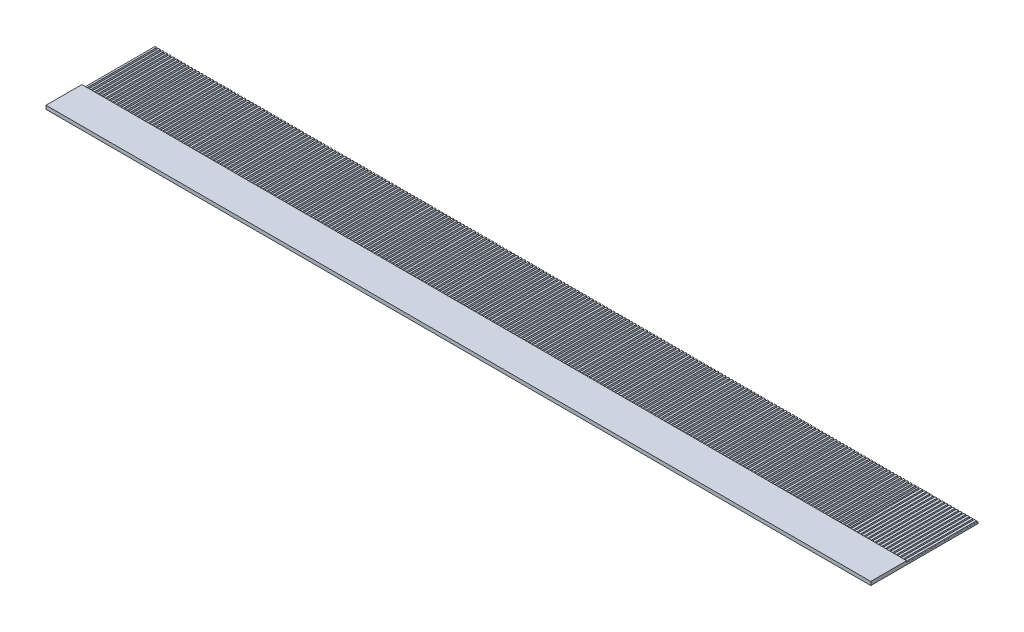
from build123d import *

# Parameters (mm, degrees)
SKETCH1_W           = 115
SKETCH1_H           = 15
BOSS_EXTRUDE1_DEPTH = 0.5
SKETCH3_W           = 115
SKETCH3_H           = 10
CUT_EXTRUDE3_DEPTH  = 0.25
SKETCH5_W           = 0.25
SKETCH5_H           = 10
CUT_EXTRUDE5_DEPTH  = 1
SKETCH6_W           = 118.166376746
SKETCH6_H           = 4.208284173
CUT_EXTRUDE6_DEPTH  = 1
SKETCH7_W           = 0.193475549
SKETCH7_H           = 9.95
CUT_EXTRUDE7_DEPTH  = 10
LPATTERN1_COUNT     = 150
LPATTERN1_PITCH     = 0.5


with BuildPart() as part:
    # Sketch1 → Boss-Extrude1 (new body)
    with BuildSketch(Plane(origin=(0, 0, 0), x_dir=(1, 0, 0), z_dir=(0, 1, 0))):
        with Locations((57.5, 7.5)):
            Rectangle(SKETCH1_W, SKETCH1_H)
    extrude(amount=BOSS_EXTRUDE1_DEPTH)

    # Sketch3 → Cut-Extrude3 (cut)
    with BuildSketch(Plane(origin=(0, 0.5, 0), x_dir=(1, 0, 0), z_dir=(0, 1, 0))):
        with Locations((57.5, 10)):
            Rectangle(SKETCH3_W, SKETCH3_H)
    extrude(amount=-CUT_EXTRUDE3_DEPTH, mode=Mode.SUBTRACT)

    # Sketch5 → Cut-Extrude5 (cut)
    with BuildSketch(Plane(origin=(0, 0.25, 0), x_dir=(1, 0, 0), z_dir=(0, 1, 0))):
        with Locations((0.125, 10)):
            Rectangle(SKETCH5_W, SKETCH5_H)
        with Locations((0.620446679, 9.998961906)):
            Rectangle(SKETCH5_W, SKETCH5_H)
        with Locations((1.116352193, 10.002779153)):
            Rectangle(SKETCH5_W, SKETCH5_H)
        with Locations((1.620868249, 10.001962647)):
            Rectangle(SKETCH5_W, SKETCH5_H)
        with Locations((2.116314928, 10.000924553)):
            Rectangle(SKETCH5_W, SKETCH5_H)
        with Locations((2.612220442, 10.0047418)):
            Rectangle(SKETCH5_W, SKETCH5_H)
        with Locations((3.139907648, 9.997960294)):
            Rectangle(SKETCH5_W, SKETCH5_H)
        with Locations((3.635354327, 9.996922201)):
            Rectangle(SKETCH5_W, SKETCH5_H)
        with Locations((4.13125984, 10.000739447)):
            Rectangle(SKETCH5_W, SKETCH5_H)
        with Locations((4.635775897, 9.999922941)):
            Rectangle(SKETCH5_W, SKETCH5_H)
        with Locations((5.131222576, 9.998884848)):
            Rectangle(SKETCH5_W, SKETCH5_H)
        with Locations((5.62712809, 10.002702094)):
            Rectangle(SKETCH5_W, SKETCH5_H)
        with Locations((6.106126495, 9.996343927)):
            Rectangle(SKETCH5_W, SKETCH5_H)
        with Locations((6.601573174, 9.995305834)):
            Rectangle(SKETCH5_W, SKETCH5_H)
        with Locations((7.097478688, 9.99912308)):
            Rectangle(SKETCH5_W, SKETCH5_H)
        with Locations((7.601994745, 9.998306574)):
            Rectangle(SKETCH5_W, SKETCH5_H)
        with Locations((8.097441424, 9.997268481)):
            Rectangle(SKETCH5_W, SKETCH5_H)
        with Locations((8.593346937, 10.001085727)):
            Rectangle(SKETCH5_W, SKETCH5_H)
        with Locations((9.121034143, 9.994304222)):
            Rectangle(SKETCH5_W, SKETCH5_H)
        with Locations((9.616480822, 9.993266128)):
            Rectangle(SKETCH5_W, SKETCH5_H)
        with Locations((10.112386336, 9.997083374)):
            Rectangle(SKETCH5_W, SKETCH5_H)
        with Locations((10.616902392, 9.996266869)):
            Rectangle(SKETCH5_W, SKETCH5_H)
        with Locations((11.112349071, 9.995228775)):
            Rectangle(SKETCH5_W, SKETCH5_H)
        with Locations((11.608254585, 9.999046021)):
            Rectangle(SKETCH5_W, SKETCH5_H)
        with Locations((12.097394126, 10.029678014)):
            Rectangle(SKETCH5_W, SKETCH5_H)
        with Locations((12.592840805, 10.02863992)):
            Rectangle(SKETCH5_W, SKETCH5_H)
        with Locations((13.088746319, 10.032457167)):
            Rectangle(SKETCH5_W, SKETCH5_H)
        with Locations((13.593262375, 10.031640661)):
            Rectangle(SKETCH5_W, SKETCH5_H)
        with Locations((14.088709054, 10.030602567)):
            Rectangle(SKETCH5_W, SKETCH5_H)
        with Locations((14.584614568, 10.034419814)):
            Rectangle(SKETCH5_W, SKETCH5_H)
        with Locations((15.112301774, 10.027638308)):
            Rectangle(SKETCH5_W, SKETCH5_H)
        with Locations((15.607748453, 10.026600215)):
            Rectangle(SKETCH5_W, SKETCH5_H)
        with Locations((16.103653966, 10.030417461)):
            Rectangle(SKETCH5_W, SKETCH5_H)
        with Locations((16.608170023, 10.029600955)):
            Rectangle(SKETCH5_W, SKETCH5_H)
        with Locations((17.103616702, 10.028562862)):
            Rectangle(SKETCH5_W, SKETCH5_H)
        with Locations((17.599522216, 10.032380108)):
            Rectangle(SKETCH5_W, SKETCH5_H)
        with Locations((18.078520622, 10.026021941)):
            Rectangle(SKETCH5_W, SKETCH5_H)
        with Locations((18.573967301, 10.024983848)):
            Rectangle(SKETCH5_W, SKETCH5_H)
        with Locations((19.069872814, 10.028801094)):
            Rectangle(SKETCH5_W, SKETCH5_H)
        with Locations((19.574388871, 10.027984588)):
            Rectangle(SKETCH5_W, SKETCH5_H)
        with Locations((20.06983555, 10.026946495)):
            Rectangle(SKETCH5_W, SKETCH5_H)
        with Locations((20.565741064, 10.030763741)):
            Rectangle(SKETCH5_W, SKETCH5_H)
        with Locations((21.093428269, 10.023982236)):
            Rectangle(SKETCH5_W, SKETCH5_H)
        with Locations((21.588874948, 10.022944142)):
            Rectangle(SKETCH5_W, SKETCH5_H)
        with Locations((22.084780462, 10.026761388)):
            Rectangle(SKETCH5_W, SKETCH5_H)
        with Locations((22.589296518, 10.025944883)):
            Rectangle(SKETCH5_W, SKETCH5_H)
        with Locations((23.084743197, 10.024906789)):
            Rectangle(SKETCH5_W, SKETCH5_H)
        with Locations((23.580648711, 10.028724035)):
            Rectangle(SKETCH5_W, SKETCH5_H)
        with Locations((24.100852619, 10.024757009)):
            Rectangle(SKETCH5_W, SKETCH5_H)
        with Locations((24.596299298, 10.023718915)):
            Rectangle(SKETCH5_W, SKETCH5_H)
        with Locations((25.092204812, 10.027536162)):
            Rectangle(SKETCH5_W, SKETCH5_H)
        with Locations((25.596720868, 10.026719656)):
            Rectangle(SKETCH5_W, SKETCH5_H)
        with Locations((26.092167547, 10.025681562)):
            Rectangle(SKETCH5_W, SKETCH5_H)
        with Locations((26.588073061, 10.029498809)):
            Rectangle(SKETCH5_W, SKETCH5_H)
        with Locations((27.115760267, 10.022717304)):
            Rectangle(SKETCH5_W, SKETCH5_H)
        with Locations((27.611206946, 10.02167921)):
            Rectangle(SKETCH5_W, SKETCH5_H)
        with Locations((28.107112459, 10.025496456)):
            Rectangle(SKETCH5_W, SKETCH5_H)
        with Locations((28.611628516, 10.02467995)):
            Rectangle(SKETCH5_W, SKETCH5_H)
        with Locations((29.107075195, 10.023641857)):
            Rectangle(SKETCH5_W, SKETCH5_H)
        with Locations((29.602980709, 10.027459103)):
            Rectangle(SKETCH5_W, SKETCH5_H)
        with Locations((30.081979114, 10.021100936)):
            Rectangle(SKETCH5_W, SKETCH5_H)
        with Locations((30.577425793, 10.020062843)):
            Rectangle(SKETCH5_W, SKETCH5_H)
        with Locations((31.073331307, 10.023880089)):
            Rectangle(SKETCH5_W, SKETCH5_H)
        with Locations((31.577847364, 10.023063583)):
            Rectangle(SKETCH5_W, SKETCH5_H)
        with Locations((32.073294043, 10.02202549)):
            Rectangle(SKETCH5_W, SKETCH5_H)
        with Locations((32.569199556, 10.025842736)):
            Rectangle(SKETCH5_W, SKETCH5_H)
        with Locations((33.096886762, 10.019061231)):
            Rectangle(SKETCH5_W, SKETCH5_H)
        with Locations((33.592333441, 10.018023137)):
            Rectangle(SKETCH5_W, SKETCH5_H)
        with Locations((34.088238955, 10.021840383)):
            Rectangle(SKETCH5_W, SKETCH5_H)
        with Locations((34.592755011, 10.021023878)):
            Rectangle(SKETCH5_W, SKETCH5_H)
        with Locations((35.08820169, 10.019985784)):
            Rectangle(SKETCH5_W, SKETCH5_H)
        with Locations((35.584107204, 10.02380303)):
            Rectangle(SKETCH5_W, SKETCH5_H)
        with Locations((36.073246745, 10.054435023)):
            Rectangle(SKETCH5_W, SKETCH5_H)
        with Locations((36.568693424, 10.053396929)):
            Rectangle(SKETCH5_W, SKETCH5_H)
        with Locations((37.064598938, 10.057214176)):
            Rectangle(SKETCH5_W, SKETCH5_H)
        with Locations((37.569114994, 10.05639767)):
            Rectangle(SKETCH5_W, SKETCH5_H)
        with Locations((38.064561673, 10.055359576)):
            Rectangle(SKETCH5_W, SKETCH5_H)
        with Locations((38.560467187, 10.059176823)):
            Rectangle(SKETCH5_W, SKETCH5_H)
        with Locations((39.088154393, 10.052395318)):
            Rectangle(SKETCH5_W, SKETCH5_H)
        with Locations((39.583601072, 10.051357224)):
            Rectangle(SKETCH5_W, SKETCH5_H)
        with Locations((40.079506585, 10.05517447)):
            Rectangle(SKETCH5_W, SKETCH5_H)
        with Locations((40.584022642, 10.054357964)):
            Rectangle(SKETCH5_W, SKETCH5_H)
        with Locations((41.079469321, 10.053319871)):
            Rectangle(SKETCH5_W, SKETCH5_H)
        with Locations((41.575374835, 10.057137117)):
            Rectangle(SKETCH5_W, SKETCH5_H)
        with Locations((42.054373241, 10.05077895)):
            Rectangle(SKETCH5_W, SKETCH5_H)
        with Locations((42.54981992, 10.049740857)):
            Rectangle(SKETCH5_W, SKETCH5_H)
        with Locations((43.045725433, 10.053558103)):
            Rectangle(SKETCH5_W, SKETCH5_H)
        with Locations((43.55024149, 10.052741597)):
            Rectangle(SKETCH5_W, SKETCH5_H)
        with Locations((44.045688169, 10.051703504)):
            Rectangle(SKETCH5_W, SKETCH5_H)
        with Locations((44.541593683, 10.05552075)):
            Rectangle(SKETCH5_W, SKETCH5_H)
        with Locations((45.069280888, 10.048739245)):
            Rectangle(SKETCH5_W, SKETCH5_H)
        with Locations((45.564727567, 10.047701151)):
            Rectangle(SKETCH5_W, SKETCH5_H)
        with Locations((46.060633081, 10.051518397)):
            Rectangle(SKETCH5_W, SKETCH5_H)
        with Locations((46.565149137, 10.050701892)):
            Rectangle(SKETCH5_W, SKETCH5_H)
        with Locations((47.060595816, 10.049663798)):
            Rectangle(SKETCH5_W, SKETCH5_H)
        with Locations((47.55650133, 10.053481044)):
            Rectangle(SKETCH5_W, SKETCH5_H)
        with Locations((48.060902316, 9.957855161)):
            Rectangle(SKETCH5_W, SKETCH5_H)
        with Locations((48.556348995, 9.956817068)):
            Rectangle(SKETCH5_W, SKETCH5_H)
        with Locations((49.052254509, 9.960634314)):
            Rectangle(SKETCH5_W, SKETCH5_H)
        with Locations((49.556770565, 9.959817808)):
            Rectangle(SKETCH5_W, SKETCH5_H)
        with Locations((50.052217244, 9.958779715)):
            Rectangle(SKETCH5_W, SKETCH5_H)
        with Locations((50.548122758, 9.962596961)):
            Rectangle(SKETCH5_W, SKETCH5_H)
        with Locations((51.075809963, 9.955815456)):
            Rectangle(SKETCH5_W, SKETCH5_H)
        with Locations((51.571256642, 9.954777362)):
            Rectangle(SKETCH5_W, SKETCH5_H)
        with Locations((52.067162156, 9.958594608)):
            Rectangle(SKETCH5_W, SKETCH5_H)
        with Locations((52.571678213, 9.957778103)):
            Rectangle(SKETCH5_W, SKETCH5_H)
        with Locations((53.067124892, 9.956740009)):
            Rectangle(SKETCH5_W, SKETCH5_H)
        with Locations((53.563030405, 9.960557255)):
            Rectangle(SKETCH5_W, SKETCH5_H)
        with Locations((54.042028811, 9.954199089)):
            Rectangle(SKETCH5_W, SKETCH5_H)
        with Locations((54.53747549, 9.953160995)):
            Rectangle(SKETCH5_W, SKETCH5_H)
        with Locations((55.033381004, 9.956978241)):
            Rectangle(SKETCH5_W, SKETCH5_H)
        with Locations((55.537897061, 9.956161736)):
            Rectangle(SKETCH5_W, SKETCH5_H)
        with Locations((56.03334374, 9.955123642)):
            Rectangle(SKETCH5_W, SKETCH5_H)
        with Locations((56.529249253, 9.958940888)):
            Rectangle(SKETCH5_W, SKETCH5_H)
        with Locations((57.056936459, 9.952159383)):
            Rectangle(SKETCH5_W, SKETCH5_H)
        with Locations((57.552383138, 9.951121289)):
            Rectangle(SKETCH5_W, SKETCH5_H)
        with Locations((58.048288652, 9.954938536)):
            Rectangle(SKETCH5_W, SKETCH5_H)
        with Locations((58.552804708, 9.95412203)):
            Rectangle(SKETCH5_W, SKETCH5_H)
        with Locations((59.048251387, 9.953083936)):
            Rectangle(SKETCH5_W, SKETCH5_H)
        with Locations((59.544156901, 9.956901183)):
            Rectangle(SKETCH5_W, SKETCH5_H)
        with Locations((60.033296442, 9.987533175)):
            Rectangle(SKETCH5_W, SKETCH5_H)
        with Locations((60.528743121, 9.986495082)):
            Rectangle(SKETCH5_W, SKETCH5_H)
        with Locations((61.024648635, 9.990312328)):
            Rectangle(SKETCH5_W, SKETCH5_H)
        with Locations((61.529164691, 9.989495822)):
            Rectangle(SKETCH5_W, SKETCH5_H)
        with Locations((62.02461137, 9.988457729)):
            Rectangle(SKETCH5_W, SKETCH5_H)
        with Locations((62.520516884, 9.992274975)):
            Rectangle(SKETCH5_W, SKETCH5_H)
        with Locations((63.04820409, 9.98549347)):
            Rectangle(SKETCH5_W, SKETCH5_H)
        with Locations((63.543650769, 9.984455376)):
            Rectangle(SKETCH5_W, SKETCH5_H)
        with Locations((64.039556282, 9.988272622)):
            Rectangle(SKETCH5_W, SKETCH5_H)
        with Locations((64.544072339, 9.987456117)):
            Rectangle(SKETCH5_W, SKETCH5_H)
        with Locations((65.039519018, 9.986418023)):
            Rectangle(SKETCH5_W, SKETCH5_H)
        with Locations((65.535424532, 9.990235269)):
            Rectangle(SKETCH5_W, SKETCH5_H)
        with Locations((66.014422937, 9.983877103)):
            Rectangle(SKETCH5_W, SKETCH5_H)
        with Locations((66.509869616, 9.982839009)):
            Rectangle(SKETCH5_W, SKETCH5_H)
        with Locations((67.00577513, 9.986656255)):
            Rectangle(SKETCH5_W, SKETCH5_H)
        with Locations((67.510291187, 9.98583975)):
            Rectangle(SKETCH5_W, SKETCH5_H)
        with Locations((68.005737866, 9.984801656)):
            Rectangle(SKETCH5_W, SKETCH5_H)
        with Locations((68.501643379, 9.988618902)):
            Rectangle(SKETCH5_W, SKETCH5_H)
        with Locations((69.029330585, 9.981837397)):
            Rectangle(SKETCH5_W, SKETCH5_H)
        with Locations((69.524777264, 9.980799303)):
            Rectangle(SKETCH5_W, SKETCH5_H)
        with Locations((70.020682778, 9.98461655)):
            Rectangle(SKETCH5_W, SKETCH5_H)
        with Locations((70.525198834, 9.983800044)):
            Rectangle(SKETCH5_W, SKETCH5_H)
        with Locations((71.020645513, 9.98276195)):
            Rectangle(SKETCH5_W, SKETCH5_H)
        with Locations((71.516551027, 9.986579197)):
            Rectangle(SKETCH5_W, SKETCH5_H)
        with Locations((72.036754935, 9.982612171)):
            Rectangle(SKETCH5_W, SKETCH5_H)
        with Locations((72.532201614, 9.981574077)):
            Rectangle(SKETCH5_W, SKETCH5_H)
        with Locations((73.028107128, 9.985391323)):
            Rectangle(SKETCH5_W, SKETCH5_H)
        with Locations((73.532623184, 9.984574818)):
            Rectangle(SKETCH5_W, SKETCH5_H)
        with Locations((74.028069863, 9.983536724)):
            Rectangle(SKETCH5_W, SKETCH5_H)
        with Locations((74.523975377, 9.98735397)):
            Rectangle(SKETCH5_W, SKETCH5_H)
        with Locations((75.051662582, 9.980572465)):
            Rectangle(SKETCH5_W, SKETCH5_H)
        with Locations((75.547109261, 9.979534371)):
            Rectangle(SKETCH5_W, SKETCH5_H)
        with Locations((76.043014775, 9.983351618)):
            Rectangle(SKETCH5_W, SKETCH5_H)
        with Locations((76.547530832, 9.982535112)):
            Rectangle(SKETCH5_W, SKETCH5_H)
        with Locations((77.042977511, 9.981497018)):
            Rectangle(SKETCH5_W, SKETCH5_H)
        with Locations((77.538883024, 9.985314264)):
            Rectangle(SKETCH5_W, SKETCH5_H)
        with Locations((78.01788143, 9.978956098)):
            Rectangle(SKETCH5_W, SKETCH5_H)
        with Locations((78.513328109, 9.977918004)):
            Rectangle(SKETCH5_W, SKETCH5_H)
        with Locations((79.009233623, 9.98173525)):
            Rectangle(SKETCH5_W, SKETCH5_H)
        with Locations((79.51374968, 9.980918745)):
            Rectangle(SKETCH5_W, SKETCH5_H)
        with Locations((80.009196359, 9.979880651)):
            Rectangle(SKETCH5_W, SKETCH5_H)
        with Locations((80.505101872, 9.983697897)):
            Rectangle(SKETCH5_W, SKETCH5_H)
        with Locations((81.032789078, 9.976916392)):
            Rectangle(SKETCH5_W, SKETCH5_H)
        with Locations((81.528235757, 9.975878299)):
            Rectangle(SKETCH5_W, SKETCH5_H)
        with Locations((82.024141271, 9.979695545)):
            Rectangle(SKETCH5_W, SKETCH5_H)
        with Locations((82.528657327, 9.978879039)):
            Rectangle(SKETCH5_W, SKETCH5_H)
        with Locations((83.024104006, 9.977840946)):
            Rectangle(SKETCH5_W, SKETCH5_H)
        with Locations((83.52000952, 9.981658192)):
            Rectangle(SKETCH5_W, SKETCH5_H)
        with Locations((84.009149061, 10.012290185)):
            Rectangle(SKETCH5_W, SKETCH5_H)
        with Locations((84.50459574, 10.011252091)):
            Rectangle(SKETCH5_W, SKETCH5_H)
        with Locations((85.000501254, 10.015069337)):
            Rectangle(SKETCH5_W, SKETCH5_H)
        with Locations((85.50501731, 10.014252832)):
            Rectangle(SKETCH5_W, SKETCH5_H)
        with Locations((86.000463989, 10.013214738)):
            Rectangle(SKETCH5_W, SKETCH5_H)
        with Locations((86.496369503, 10.017031984)):
            Rectangle(SKETCH5_W, SKETCH5_H)
        with Locations((87.024056709, 10.010250479)):
            Rectangle(SKETCH5_W, SKETCH5_H)
        with Locations((87.519503388, 10.009212385)):
            Rectangle(SKETCH5_W, SKETCH5_H)
        with Locations((88.015408901, 10.013029632)):
            Rectangle(SKETCH5_W, SKETCH5_H)
        with Locations((88.519924958, 10.012213126)):
            Rectangle(SKETCH5_W, SKETCH5_H)
        with Locations((89.015371637, 10.011175032)):
            Rectangle(SKETCH5_W, SKETCH5_H)
        with Locations((89.511277151, 10.014992278)):
            Rectangle(SKETCH5_W, SKETCH5_H)
        with Locations((89.990275556, 10.008634112)):
            Rectangle(SKETCH5_W, SKETCH5_H)
        with Locations((90.485722235, 10.007596018)):
            Rectangle(SKETCH5_W, SKETCH5_H)
        with Locations((90.981627749, 10.011413264)):
            Rectangle(SKETCH5_W, SKETCH5_H)
        with Locations((91.486143806, 10.010596759)):
            Rectangle(SKETCH5_W, SKETCH5_H)
        with Locations((91.981590485, 10.009558665)):
            Rectangle(SKETCH5_W, SKETCH5_H)
        with Locations((92.477495998, 10.013375911)):
            Rectangle(SKETCH5_W, SKETCH5_H)
        with Locations((93.005183204, 10.006594406)):
            Rectangle(SKETCH5_W, SKETCH5_H)
        with Locations((93.500629883, 10.005556313)):
            Rectangle(SKETCH5_W, SKETCH5_H)
        with Locations((93.996535397, 10.009373559)):
            Rectangle(SKETCH5_W, SKETCH5_H)
        with Locations((94.501051453, 10.008557053)):
            Rectangle(SKETCH5_W, SKETCH5_H)
        with Locations((94.996498132, 10.00751896)):
            Rectangle(SKETCH5_W, SKETCH5_H)
        with Locations((95.492403646, 10.011336206)):
            Rectangle(SKETCH5_W, SKETCH5_H)
        with Locations((95.961193403, 10.019132397)):
            Rectangle(SKETCH5_W, SKETCH5_H)
        with Locations((96.46570946, 10.018315892)):
            Rectangle(SKETCH5_W, SKETCH5_H)
        with Locations((96.961156139, 10.017277798)):
            Rectangle(SKETCH5_W, SKETCH5_H)
        with Locations((97.457061652, 10.021095044)):
            Rectangle(SKETCH5_W, SKETCH5_H)
        with Locations((97.984748858, 10.014313539)):
            Rectangle(SKETCH5_W, SKETCH5_H)
        with Locations((98.480195537, 10.013275445)):
            Rectangle(SKETCH5_W, SKETCH5_H)
        with Locations((98.976101051, 10.017092692)):
            Rectangle(SKETCH5_W, SKETCH5_H)
        with Locations((99.480617107, 10.016276186)):
            Rectangle(SKETCH5_W, SKETCH5_H)
        with Locations((99.976063786, 10.015238092)):
            Rectangle(SKETCH5_W, SKETCH5_H)
        with Locations((100.4719693, 10.019055339)):
            Rectangle(SKETCH5_W, SKETCH5_H)
        with Locations((100.950967706, 10.012697172)):
            Rectangle(SKETCH5_W, SKETCH5_H)
        with Locations((101.446414385, 10.011659078)):
            Rectangle(SKETCH5_W, SKETCH5_H)
        with Locations((101.942319899, 10.015476324)):
            Rectangle(SKETCH5_W, SKETCH5_H)
        with Locations((102.446835955, 10.014659819)):
            Rectangle(SKETCH5_W, SKETCH5_H)
        with Locations((102.942282634, 10.013621725)):
            Rectangle(SKETCH5_W, SKETCH5_H)
        with Locations((103.438188148, 10.017438971)):
            Rectangle(SKETCH5_W, SKETCH5_H)
        with Locations((103.965875353, 10.010657466)):
            Rectangle(SKETCH5_W, SKETCH5_H)
        with Locations((104.461322032, 10.009619373)):
            Rectangle(SKETCH5_W, SKETCH5_H)
        with Locations((104.957227546, 10.013436619)):
            Rectangle(SKETCH5_W, SKETCH5_H)
        with Locations((105.461743603, 10.012620113)):
            Rectangle(SKETCH5_W, SKETCH5_H)
        with Locations((105.957190282, 10.01158202)):
            Rectangle(SKETCH5_W, SKETCH5_H)
        with Locations((106.453095795, 10.015399266)):
            Rectangle(SKETCH5_W, SKETCH5_H)
    extrude(amount=-CUT_EXTRUDE5_DEPTH, mode=Mode.SUBTRACT)

    # Sketch6 → Cut-Extrude6 (cut)
    with BuildSketch(Plane(origin=(0, 0.5, 0), x_dir=(1, 0, 0), z_dir=(0, 1, 0))):
        with Locations((55.916811627, 17.054142087)):
            Rectangle(SKETCH6_W, SKETCH6_H)
    extrude(amount=-CUT_EXTRUDE6_DEPTH, mode=Mode.SUBTRACT)

    # Sketch7 → Cut-Extrude7 (cut)
    with BuildSketch(Plane(origin=(0, 0.25, 0), x_dir=(1, 0, 0), z_dir=(0, 1, 0))):
        with Locations((106.897469383, 9.975)):
            Rectangle(SKETCH7_W, SKETCH7_H)
    cut_extrude7 = extrude(amount=-CUT_EXTRUDE7_DEPTH, mode=Mode.SUBTRACT)

    # LPattern1: Cut-Extrude7 ×150
    with Locations(*[(i * LPATTERN1_PITCH, 0, 0) for i in range(1, LPATTERN1_COUNT)]):
        add(cut_extrude7, mode=Mode.SUBTRACT)


solid = part.part
